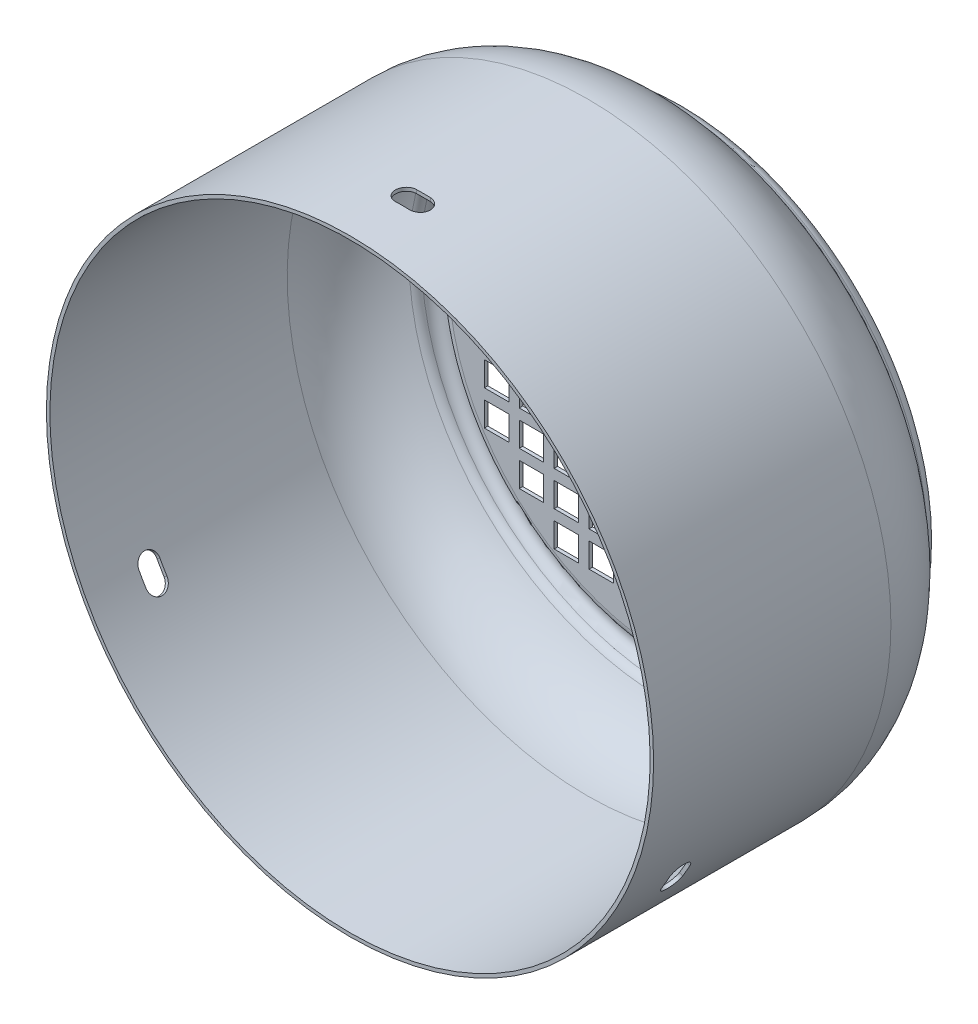
from build123d import *

# Parameters (mm, degrees)
SKETCH_2_W               = 7
SKETCH_2_H               = 7
CUT_EXTRUDE_1_DEPTH      = 155.230347321
CUT_EXTRUDE_2_DEPTH      = 90
PATTERN_CIRCULAR_1_COUNT = 3
SCALE_1_SCALE            = 0.25


with BuildPart() as part:
    # 草图1 → 旋转-薄壁2 (revolve)
    with BuildSketch(Plane(origin=(0, 0, 0), x_dir=(0, 0, -1), z_dir=(1, 0, 0))):
        with BuildLine():
            Line((0, 86), (68, 86))
            ThreePointArc((68, 86), (80.801889426, 82.629883498), (90.285020482, 73.393202086))
            ThreePointArc((90.285020482, 73.393202086), (91.196193108, 72.439808661), (92.4281845, 71.969285778))
            ThreePointArc((92.4281845, 71.969285778), (94.945904572, 69.567138654), (93.5, 66.401923789))
            ThreePointArc((93.5, 66.401923789), (92.401923789, 65.303847577), (92, 63.803847577))
            Line((92, 63.803847577), (92, 0))
            Line((92, 0), (93, 0))
            Line((93, 0), (93, 63.803847577))
            ThreePointArc((93, 63.803847577), (93.267949192, 64.803847577), (94, 65.535898385))
            ThreePointArc((94, 65.535898385), (95.927872763, 69.756184871), (92.570912666, 72.959047705))
            ThreePointArc((92.570912666, 72.959047705), (91.749585072, 73.272729627), (91.142136655, 73.908325243))
            ThreePointArc((91.142136655, 73.908325243), (81.294269789, 83.500263632), (68, 87))
            Line((68, 87), (0, 87))
            Line((0, 87), (0, 86))
        make_face()
    revolve(axis=Axis((0, 0, 0), (0, 0, -1)))

    # 草图2 → 拉伸1 (cut, through all)
    with BuildSketch(Plane(origin=(0, 0, -93), x_dir=(-1, 0, 0), z_dir=(0, 0, -1))):
        Rectangle(SKETCH_2_W, SKETCH_2_H)
        with Locations((10, 0)):
            Rectangle(SKETCH_2_W, SKETCH_2_H)
        with Locations((20, 0)):
            Rectangle(SKETCH_2_W, SKETCH_2_H)
        with Locations((30, 0)):
            Rectangle(SKETCH_2_W, SKETCH_2_H)
        with Locations((40, 0)):
            Rectangle(SKETCH_2_W, SKETCH_2_H)
        with Locations((50, 0)):
            Rectangle(SKETCH_2_W, SKETCH_2_H)
        with Locations((0, 10)):
            Rectangle(SKETCH_2_W, SKETCH_2_H)
        with Locations((20, 10)):
            Rectangle(SKETCH_2_W, SKETCH_2_H)
        with Locations((30, 10)):
            Rectangle(SKETCH_2_W, SKETCH_2_H)
        with Locations((40, 10)):
            Rectangle(SKETCH_2_W, SKETCH_2_H)
        with Locations((50, 10)):
            Rectangle(SKETCH_2_W, SKETCH_2_H)
        with Locations((0, 20)):
            Rectangle(SKETCH_2_W, SKETCH_2_H)
        with Locations((10, 20)):
            Rectangle(SKETCH_2_W, SKETCH_2_H)
        with Locations((20, 20)):
            Rectangle(SKETCH_2_W, SKETCH_2_H)
        with Locations((30, 20)):
            Rectangle(SKETCH_2_W, SKETCH_2_H)
        with Locations((40, 20)):
            Rectangle(SKETCH_2_W, SKETCH_2_H)
        with Locations((50, 20)):
            Rectangle(SKETCH_2_W, SKETCH_2_H)
        with Locations((0, 30)):
            Rectangle(SKETCH_2_W, SKETCH_2_H)
        with Locations((10, 30)):
            Rectangle(SKETCH_2_W, SKETCH_2_H)
        with Locations((20, 30)):
            Rectangle(SKETCH_2_W, SKETCH_2_H)
        with Locations((30, 30)):
            Rectangle(SKETCH_2_W, SKETCH_2_H)
        with Locations((40, 30)):
            Rectangle(SKETCH_2_W, SKETCH_2_H)
        with Locations((50, 30)):
            Rectangle(SKETCH_2_W, SKETCH_2_H)
        with Locations((0, 40)):
            Rectangle(SKETCH_2_W, SKETCH_2_H)
        with Locations((10, 40)):
            Rectangle(SKETCH_2_W, SKETCH_2_H)
        with Locations((20, 40)):
            Rectangle(SKETCH_2_W, SKETCH_2_H)
        with Locations((30, 40)):
            Rectangle(SKETCH_2_W, SKETCH_2_H)
        with Locations((40, 40)):
            Rectangle(SKETCH_2_W, SKETCH_2_H)
        with Locations((-30, 50)):
            Rectangle(SKETCH_2_W, SKETCH_2_H)
        with Locations((0, 50)):
            Rectangle(SKETCH_2_W, SKETCH_2_H)
        with Locations((10, 50)):
            Rectangle(SKETCH_2_W, SKETCH_2_H)
        with Locations((20, 50)):
            Rectangle(SKETCH_2_W, SKETCH_2_H)
        with Locations((30, 50)):
            Rectangle(SKETCH_2_W, SKETCH_2_H)
        with Locations((-20, 50)):
            Rectangle(SKETCH_2_W, SKETCH_2_H)
        with Locations((-10, 50)):
            Rectangle(SKETCH_2_W, SKETCH_2_H)
        with Locations((-40, 40)):
            Rectangle(SKETCH_2_W, SKETCH_2_H)
        with Locations((-30, 40)):
            Rectangle(SKETCH_2_W, SKETCH_2_H)
        with Locations((-20, 40)):
            Rectangle(SKETCH_2_W, SKETCH_2_H)
        with Locations((-10, 40)):
            Rectangle(SKETCH_2_W, SKETCH_2_H)
        with Locations((-50, 30)):
            Rectangle(SKETCH_2_W, SKETCH_2_H)
        with Locations((-40, 30)):
            Rectangle(SKETCH_2_W, SKETCH_2_H)
        with Locations((-30, 30)):
            Rectangle(SKETCH_2_W, SKETCH_2_H)
        with Locations((-20, 30)):
            Rectangle(SKETCH_2_W, SKETCH_2_H)
        with Locations((-10, 30)):
            Rectangle(SKETCH_2_W, SKETCH_2_H)
        with Locations((-50, 20)):
            Rectangle(SKETCH_2_W, SKETCH_2_H)
        with Locations((-40, 20)):
            Rectangle(SKETCH_2_W, SKETCH_2_H)
        with Locations((-30, 20)):
            Rectangle(SKETCH_2_W, SKETCH_2_H)
        with Locations((-20, 20)):
            Rectangle(SKETCH_2_W, SKETCH_2_H)
        with Locations((-10, 20)):
            Rectangle(SKETCH_2_W, SKETCH_2_H)
        with Locations((-50, 10)):
            Rectangle(SKETCH_2_W, SKETCH_2_H)
        with Locations((-40, 10)):
            Rectangle(SKETCH_2_W, SKETCH_2_H)
        with Locations((-30, 10)):
            Rectangle(SKETCH_2_W, SKETCH_2_H)
        with Locations((-20, 10)):
            Rectangle(SKETCH_2_W, SKETCH_2_H)
        with Locations((-50, 0)):
            Rectangle(SKETCH_2_W, SKETCH_2_H)
        with Locations((-40, 0)):
            Rectangle(SKETCH_2_W, SKETCH_2_H)
        with Locations((-30, 0)):
            Rectangle(SKETCH_2_W, SKETCH_2_H)
        with Locations((-20, 0)):
            Rectangle(SKETCH_2_W, SKETCH_2_H)
        with Locations((-10, 0)):
            Rectangle(SKETCH_2_W, SKETCH_2_H)
        with Locations((-20, -10)):
            Rectangle(SKETCH_2_W, SKETCH_2_H)
        with Locations((-30, -10)):
            Rectangle(SKETCH_2_W, SKETCH_2_H)
        with Locations((-40, -10)):
            Rectangle(SKETCH_2_W, SKETCH_2_H)
        with Locations((-50, -10)):
            Rectangle(SKETCH_2_W, SKETCH_2_H)
        with Locations((-10, -20)):
            Rectangle(SKETCH_2_W, SKETCH_2_H)
        with Locations((-20, -20)):
            Rectangle(SKETCH_2_W, SKETCH_2_H)
        with Locations((-30, -20)):
            Rectangle(SKETCH_2_W, SKETCH_2_H)
        with Locations((-40, -20)):
            Rectangle(SKETCH_2_W, SKETCH_2_H)
        with Locations((-50, -20)):
            Rectangle(SKETCH_2_W, SKETCH_2_H)
        with Locations((-10, -30)):
            Rectangle(SKETCH_2_W, SKETCH_2_H)
        with Locations((-20, -30)):
            Rectangle(SKETCH_2_W, SKETCH_2_H)
        with Locations((-30, -30)):
            Rectangle(SKETCH_2_W, SKETCH_2_H)
        with Locations((-40, -30)):
            Rectangle(SKETCH_2_W, SKETCH_2_H)
        with Locations((-50, -30)):
            Rectangle(SKETCH_2_W, SKETCH_2_H)
        with Locations((-10, -40)):
            Rectangle(SKETCH_2_W, SKETCH_2_H)
        with Locations((-20, -40)):
            Rectangle(SKETCH_2_W, SKETCH_2_H)
        with Locations((-30, -40)):
            Rectangle(SKETCH_2_W, SKETCH_2_H)
        with Locations((-40, -40)):
            Rectangle(SKETCH_2_W, SKETCH_2_H)
        with Locations((-10, -50)):
            Rectangle(SKETCH_2_W, SKETCH_2_H)
        with Locations((-20, -50)):
            Rectangle(SKETCH_2_W, SKETCH_2_H)
        with Locations((-30, -50)):
            Rectangle(SKETCH_2_W, SKETCH_2_H)
        with Locations((30, -50)):
            Rectangle(SKETCH_2_W, SKETCH_2_H)
        with Locations((20, -50)):
            Rectangle(SKETCH_2_W, SKETCH_2_H)
        with Locations((10, -50)):
            Rectangle(SKETCH_2_W, SKETCH_2_H)
        with Locations((0, -50)):
            Rectangle(SKETCH_2_W, SKETCH_2_H)
        with Locations((40, -40)):
            Rectangle(SKETCH_2_W, SKETCH_2_H)
        with Locations((30, -40)):
            Rectangle(SKETCH_2_W, SKETCH_2_H)
        with Locations((20, -40)):
            Rectangle(SKETCH_2_W, SKETCH_2_H)
        with Locations((10, -40)):
            Rectangle(SKETCH_2_W, SKETCH_2_H)
        with Locations((0, -40)):
            Rectangle(SKETCH_2_W, SKETCH_2_H)
        with Locations((50, -30)):
            Rectangle(SKETCH_2_W, SKETCH_2_H)
        with Locations((40, -30)):
            Rectangle(SKETCH_2_W, SKETCH_2_H)
        with Locations((30, -30)):
            Rectangle(SKETCH_2_W, SKETCH_2_H)
        with Locations((20, -30)):
            Rectangle(SKETCH_2_W, SKETCH_2_H)
        with Locations((10, -30)):
            Rectangle(SKETCH_2_W, SKETCH_2_H)
        with Locations((0, -30)):
            Rectangle(SKETCH_2_W, SKETCH_2_H)
        with Locations((50, -20)):
            Rectangle(SKETCH_2_W, SKETCH_2_H)
        with Locations((40, -20)):
            Rectangle(SKETCH_2_W, SKETCH_2_H)
        with Locations((30, -20)):
            Rectangle(SKETCH_2_W, SKETCH_2_H)
        with Locations((20, -20)):
            Rectangle(SKETCH_2_W, SKETCH_2_H)
        with Locations((10, -20)):
            Rectangle(SKETCH_2_W, SKETCH_2_H)
        with Locations((0, -20)):
            Rectangle(SKETCH_2_W, SKETCH_2_H)
        with Locations((50, -10)):
            Rectangle(SKETCH_2_W, SKETCH_2_H)
        with Locations((40, -10)):
            Rectangle(SKETCH_2_W, SKETCH_2_H)
        with Locations((30, -10)):
            Rectangle(SKETCH_2_W, SKETCH_2_H)
        with Locations((20, -10)):
            Rectangle(SKETCH_2_W, SKETCH_2_H)
        with Locations((0, -10)):
            Rectangle(SKETCH_2_W, SKETCH_2_H)
    extrude(amount=-CUT_EXTRUDE_1_DEPTH, mode=Mode.SUBTRACT)

    # 草图3 → 拉伸2 (cut)
    with BuildSketch(Plane(origin=(0, 0, 0), x_dir=(1, 0, 0), z_dir=(0, 1, 0))):
        with BuildLine():
            Line((-2, 21), (2, 21))
            ThreePointArc((2, 21), (5, 18), (2, 15))
            Line((2, 15), (-2, 15))
            ThreePointArc((-2, 15), (-5, 18), (-2, 21))
        make_face()
    cut_extrude_2 = extrude(amount=CUT_EXTRUDE_2_DEPTH, mode=Mode.SUBTRACT)

    # 阵列(圆周)1: 拉伸2 ×3 about axis
    pattern_circular_1_axis = Axis((0, 0, 0), (0, 0, 1))
    for i in range(1, PATTERN_CIRCULAR_1_COUNT):
        add(cut_extrude_2.rotate(pattern_circular_1_axis, i * 360 / PATTERN_CIRCULAR_1_COUNT), mode=Mode.SUBTRACT)


with BuildPart() as part_1:
    # 缩放比例1: scaled about (0, 0, 0)
    add(part.part.scale(SCALE_1_SCALE))


solid = part_1.part
